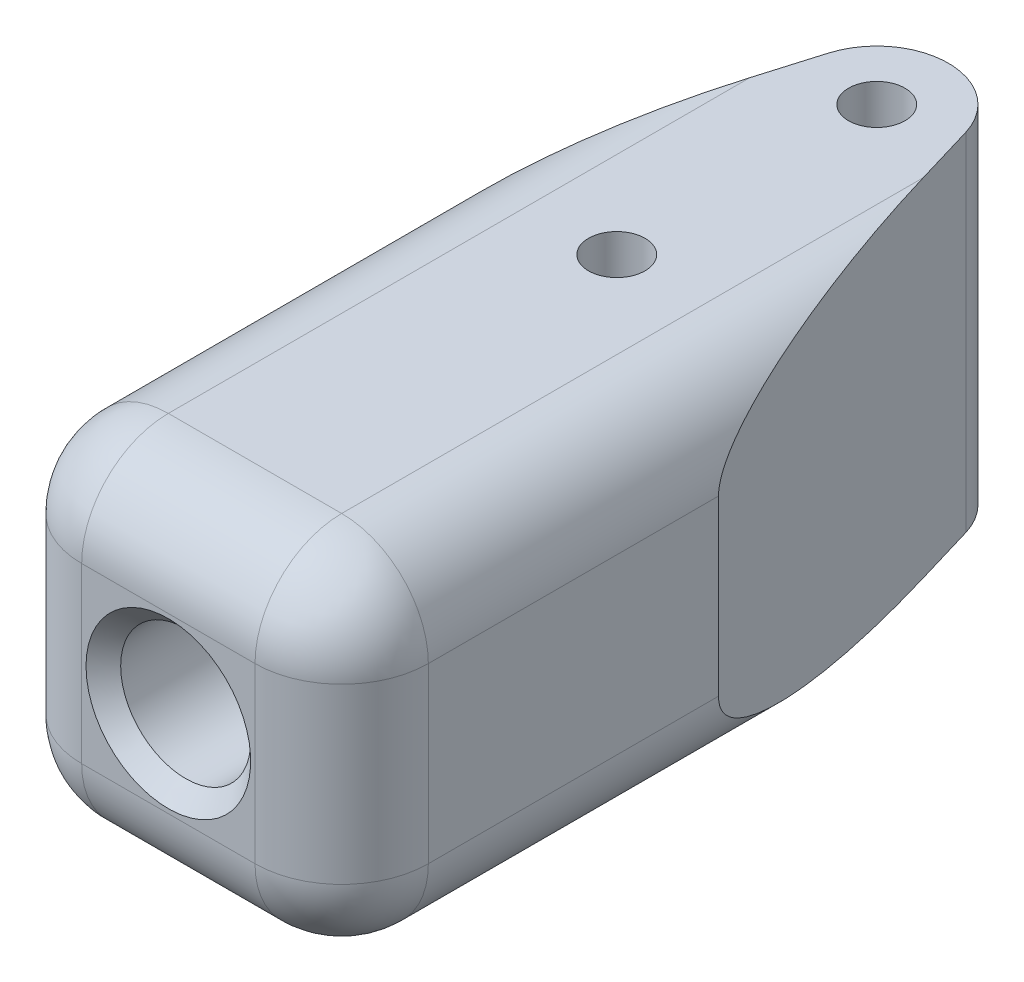
from build123d import *

# Parameters (mm, degrees)
SKETCH1_W               = 25.4
SKETCH1_H               = 25.4
BOSS_EXTRUDE1_DEPTH     = 57.15
CUT_EXTRUDE1_DEPTH      = 64.816710194
CUT_EXTRUDE1_DEPTH_BACK = 64.816710194
SKETCH2_R               = 2.0701
SKETCH4_R               = 4.7625
CUT_EXTRUDE2_DEPTH      = 25.4
CHAMFER1_SIZE           = 1.27
FILLET1_R               = 6.35
FILLET2_R               = 6.35


with BuildPart() as part:
    # Sketch1 → Boss-Extrude1 (new body)
    with BuildSketch(Plane.XY):
        Rectangle(SKETCH1_W, SKETCH1_H)
    extrude(amount=BOSS_EXTRUDE1_DEPTH)

    # Sketch2 → Cut-Extrude1 (cut, two sides: drawn at the far end of the back side and taken through both)
    with BuildSketch(Plane(origin=(0, 12.7, 0), x_dir=(1, 0, 0), z_dir=(0, 1, 0)).offset(-CUT_EXTRUDE1_DEPTH_BACK)):
        with BuildLine():
            Line((-12.7, 0), (-12.7, -29.5402))
            Line((-12.7, -29.5402), (-5.027345066, -3.749481199))
            ThreePointArc((-5.027345066, -3.749481199), (-3.135793664, -1.040593833), (7e-09, 0))
            Line((7e-09, 0), (-12.7, 0))
        make_face()
        with BuildLine():
            Line((5.027345066, -3.749481199), (12.7, -29.5402))
            Line((12.7, -29.5402), (12.7, 0))
            Line((12.7, 0), (7e-09, 0))
            ThreePointArc((7e-09, 0), (3.135793669, -1.040593837), (5.027345066, -3.749481199))
        make_face()
        with Locations((0, -5.2451)):
            Circle(SKETCH2_R)
        with Locations((0, -24.2951)):
            Circle(SKETCH2_R)
    extrude(amount=CUT_EXTRUDE1_DEPTH + CUT_EXTRUDE1_DEPTH_BACK, mode=Mode.SUBTRACT)

    # Sketch4 → Cut-Extrude2 (cut)
    with BuildSketch(Plane.XY.offset(57.15)):
        Circle(SKETCH4_R)
    extrude(amount=-CUT_EXTRUDE2_DEPTH, mode=Mode.SUBTRACT)

    # Chamfer1
    chamfer1_edges = [part.edges().sort_by_distance(p)[0] for p in [
        (-4.7625, 0, 57.15),
    ]]
    chamfer(chamfer1_edges, length=CHAMFER1_SIZE)

    # Fillet1
    fillet1_edges = [part.edges().sort_by_distance(p)[0] for p in [
        (-12.7, -12.7, 43.3451),
        (12.7, -12.7, 43.3451),
        (0, -12.7, 57.15),
        (-12.7, 0, 57.15),
        (12.7, 0, 57.15),
    ]]
    fillet(fillet1_edges, radius=FILLET1_R)

    # Fillet2
    fillet2_edges = [part.edges().sort_by_distance(p)[0] for p in [
        (12.7, 12.7, 40.1701),
        (10.840128061, 12.7, 55.290128061),
        (0, 12.7, 57.15),
        (-10.840128061, 12.7, 55.290128061),
        (-12.7, 12.7, 40.1701),
    ]]
    fillet(fillet2_edges, radius=FILLET2_R)


solid = part.part
